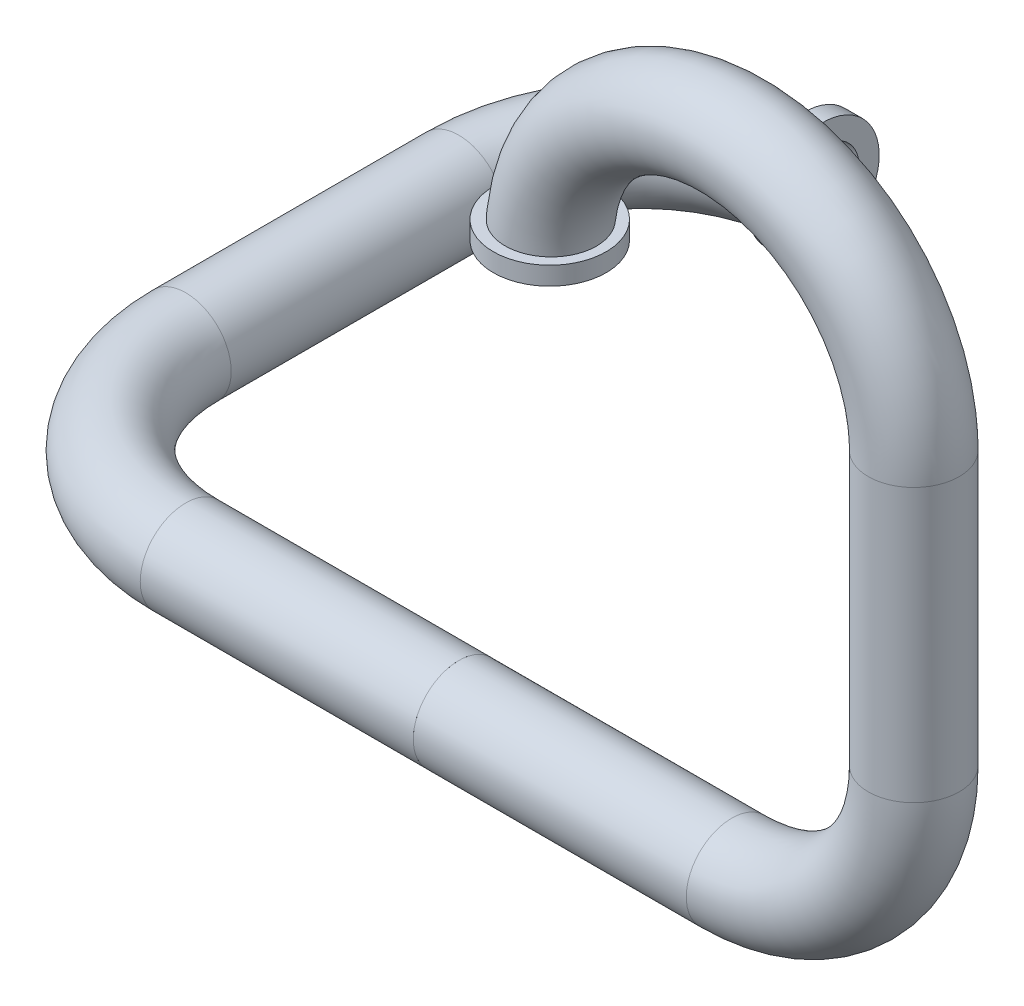
from build123d import *

# Parameters (mm, degrees)
SKETCH3_R             = 0.25
SKETCH3_R_2           = 0.2
SKETCH6_R             = 0.31
SKETCH6_R_2           = 0.21
SPLIT2_START          = -1
SPLIT2_OUTLINE_W      = 3
SPLIT2_OUTLINE_H      = 4
SPLIT2_DEPTH          = 1.31
SKETCH10_R            = 0.31
SKETCH10_R_2          = 0.21
BODY_MOVE_COPY2_ANGLE = 90


# Read off the part's stored shape, not the designer's step: Split1, Split2
with BuildPart() as part:
    # Sweep-Thin1: sweep along a path in Sketch1
    with BuildLine(Plane.XY) as sweep_thin1_path:
        Line((0.5, -2.5), (-1, -2.5))
        ThreePointArc((-1, -2.5), (-1.707106781, -2.207106781), (-2, -1.5))
        Line((-2, -1.5), (-2, 0))
        ThreePointArc((-2, 0), (-1, 1), (0, 0))
    # Sketch3 → Sweep-Thin1 (sweep)
    with BuildSketch(Plane(origin=(0, 0, 0), x_dir=(1, 0, 0), z_dir=(0, 1, 0))):
        Circle(SKETCH3_R)
        Circle(SKETCH3_R_2, mode=Mode.SUBTRACT)
    sweep(path=sweep_thin1_path.line)

    # Sweep-Thin2: sweep along a path in Sketch5
    with BuildLine(Plane.XY) as sweep_thin2_path:
        Line((0, 0), (0, 0.1))
    # Sketch6 → Sweep-Thin2 (sweep)
    with BuildSketch(Plane(origin=(0, 0, 0), x_dir=(1, 0, 0), z_dir=(0, 1, 0))):
        Circle(SKETCH6_R)
        Circle(SKETCH6_R_2, mode=Mode.SUBTRACT)
    sweep(path=sweep_thin2_path.line)

    # Mirror2: part across plane


with BuildPart() as part_1:
    add(part.part)
    add(part.part.mirror(Plane(origin=(0.5, -2.5, 0), x_dir=(0, 0, 1), z_dir=(1, 0, 0))))


with BuildPart() as body_2:
    # Split1: the piece on the far side of the plane
    add(part_1.part)
    split(bisect_by=Plane.YZ.offset(0.5), keep=Keep.BOTTOM)

    # Split2 outline → Split2 (cut)
    with BuildSketch(Plane.YZ.offset(SPLIT2_START)):
        with Locations((1.5, 0)):
            Rectangle(SPLIT2_OUTLINE_W, SPLIT2_OUTLINE_H)
    extrude(amount=SPLIT2_DEPTH, mode=Mode.SUBTRACT)

    # Sweep-Thin3: sweep along a path in Sketch11
    with BuildLine(Plane(origin=(0, 1, 0), x_dir=(1, 0, 0), z_dir=(0, 1, 0))) as sweep_thin3_path:
        Line((-1, 0), (-1.1, 0))
    # Sketch10 → Sweep-Thin3 (sweep)
    with BuildSketch(Plane(origin=(-1, 0, 0), x_dir=(0, 0, -1), z_dir=(1, 0, 0))):
        with Locations((0, 1)):
            Circle(SKETCH10_R)
        with Locations((0, 1)):
            Circle(SKETCH10_R_2, mode=Mode.SUBTRACT)
    sweep(path=sweep_thin3_path.line)


with BuildPart() as part_2:
    add(part_1.part)

    # Split1
    split(bisect_by=Plane.YZ.offset(0.5), keep=Keep.TOP)


with BuildPart() as body_2_1:
    # Body-Move/Copy2: moved
    add(body_2.part.rotate(Axis((0, -2.5, 0), (-1, 0, 0)), BODY_MOVE_COPY2_ANGLE))


solid = Compound([part_2.part, body_2_1.part])
